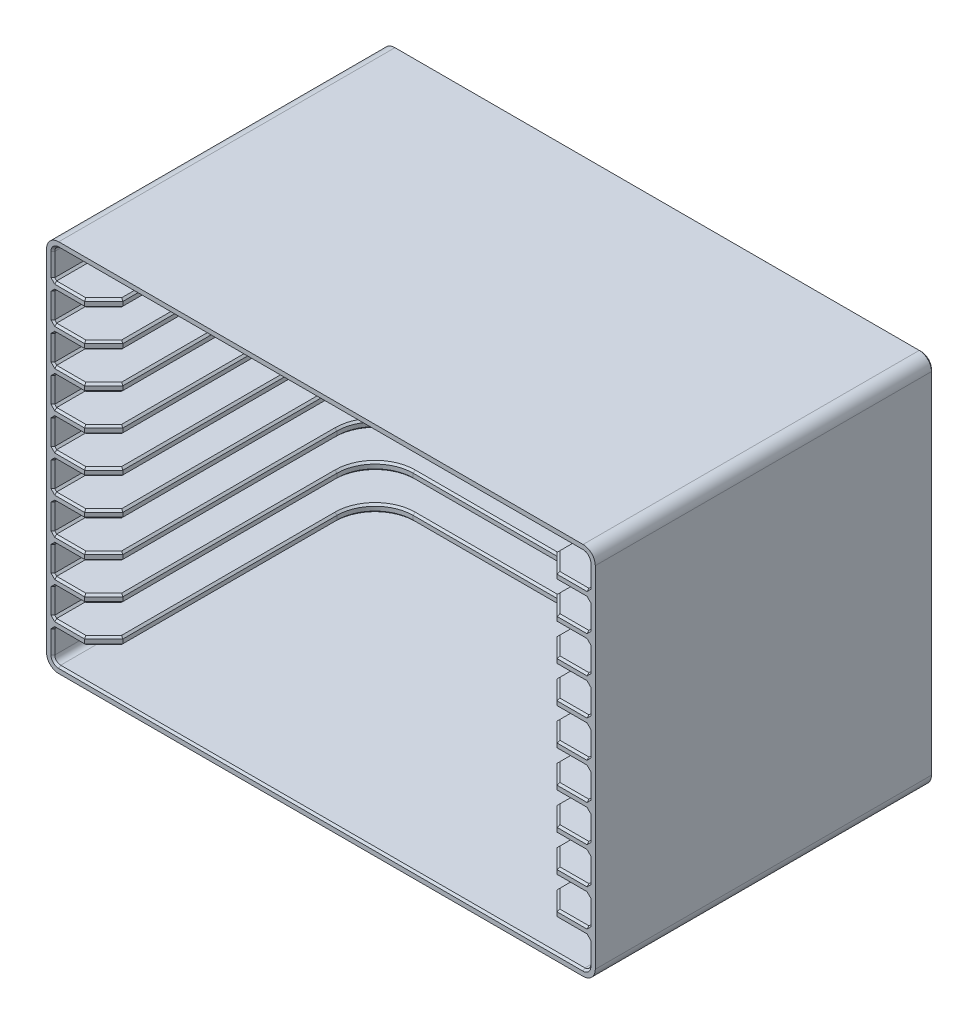
from build123d import *

# Parameters (mm, degrees)
BOSS_EXTRUDE1_DEPTH      = 106.4
CHAMFER1_SIZE            = 0.6
SHELL1_T                 = -2
SHELL1_THICKNESS_2_DEPTH = 3
DIVIDER_DEPTH            = 7
DIVIDER_POCKET_DEPTH     = 4.5
LPATTERN1_START          = -47.25
LPATTERN1_DEPTH          = 2.5
LPATTERN1_START_2        = -35.75
LPATTERN1_2_DEPTH        = 2.5
LPATTERN1_START_3        = -24.25
LPATTERN1_3_DEPTH        = 2.5
LPATTERN1_START_4        = 10.25
LPATTERN1_4_DEPTH        = 2.5
LPATTERN1_START_5        = 21.75
LPATTERN1_5_DEPTH        = 2.5
LPATTERN1_START_6        = 33.25
LPATTERN1_6_DEPTH        = 2.5
LPATTERN1_START_7        = 44.75
LPATTERN1_7_DEPTH        = 2.5
CHAMFER2_SIZE            = 0.6


# Read off the part's stored shape, not the designer's step: LPattern1
with BuildPart() as part:
    # Sketch1 → Boss-Extrude1 (new body)
    with BuildSketch(Plane.XY):
        with BuildLine():
            Line((-82.5, -58.85), (82.5, -58.85))
            ThreePointArc((82.5, -58.85), (85.222361108, -57.722361108), (86.35, -55))
            Line((86.35, -55), (86.35, 55))
            ThreePointArc((86.35, 55), (85.222361108, 57.722361108), (82.5, 58.85))
            Line((82.5, 58.85), (-82.5, 58.85))
            ThreePointArc((-82.5, 58.85), (-85.222361108, 57.722361108), (-86.35, 55))
            Line((-86.35, 55), (-86.35, -55))
            ThreePointArc((-86.35, -55), (-85.222361108, -57.722361108), (-82.5, -58.85))
        make_face()
    extrude(amount=BOSS_EXTRUDE1_DEPTH)

    # Chamfer1
    chamfer1_edges = [part.edges().sort_by_distance(p)[0] for p in [
        (0, -58.85, 0),
        (85.222361108, -57.722361108, 0),
        (86.35, 0, 0),
        (85.222361108, 57.722361108, 0),
        (0, 58.85, 0),
        (-85.222361108, 57.722361108, 0),
        (-86.35, 0, 0),
        (-85.222361108, -57.722361108, 0),
    ]]
    chamfer(chamfer1_edges, length=CHAMFER1_SIZE)

    # Shell1
    shell1_openings = [part.faces().sort_by_distance(p)[0] for p in [
        (0, 0, 106.4),
    ]]
    offset(amount=SHELL1_T, openings=shell1_openings, kind=Kind.INTERSECTION)

    # Shell1 thickness 2 face (on inner face of the shell) → Shell1 thickness 2 (add)
    with BuildSketch(Plane(origin=(0, 0, 2), x_dir=(-1, 0, 0), z_dir=(0, 0, -1))):
        with BuildLine():
            Line((-82.5, 56.85), (82.5, 56.85))
            ThreePointArc((82.5, 56.85), (83.808147545, 56.308147545), (84.35, 55))
            Line((84.35, 55), (84.35, -55))
            ThreePointArc((84.35, -55), (83.808147545, -56.308147545), (82.5, -56.85))
            Line((82.5, -56.85), (-82.5, -56.85))
            ThreePointArc((-82.5, -56.85), (-83.808147545, -56.308147545), (-84.35, -55))
            Line((-84.35, -55), (-84.35, 55))
            ThreePointArc((-84.35, 55), (-83.808147545, 56.308147545), (-82.5, 56.85))
        make_face()
    extrude(amount=-SHELL1_THICKNESS_2_DEPTH)

    # Sketch2 → Divider (add, symmetric)
    with BuildSketch(Plane(origin=(0, -5.75, 0), x_dir=(1, 0, 0), z_dir=(0, 1, 0))):
        with BuildLine():
            Line((-84.35, -106.4), (-84.35, -5))
            Line((-84.35, -5), (84.35, -5))
            Line((84.35, -5), (84.35, -106.4))
            Line((84.35, -106.4), (74.35, -106.4))
            Line((74.35, -106.4), (68.35, -100.4))
            Line((68.35, -100.4), (68.35, -33))
            ThreePointArc((68.35, -33), (64.835281374, -24.514718626), (56.35, -21))
            Line((56.35, -21), (-56.35, -21))
            ThreePointArc((-56.35, -21), (-64.835281374, -24.514718626), (-68.35, -33))
            Line((-68.35, -33), (-68.35, -100.4))
            Line((-68.35, -100.4), (-74.35, -106.4))
            Line((-74.35, -106.4), (-84.35, -106.4))
        make_face()
    extrude(amount=DIVIDER_DEPTH, both=True)

    # Sketch3 → Divider Pocket (cut, symmetric)
    with BuildSketch(Plane(origin=(0, -5.75, 0), x_dir=(1, 0, 0), z_dir=(0, 1, 0))):
        with BuildLine():
            Line((-56.35, -21), (56.35, -21))
            ThreePointArc((56.35, -21), (64.835281374, -24.514718626), (68.35, -33))
            Line((68.35, -33), (68.35, -100.4))
            Line((68.35, -100.4), (74.35, -106.4))
            Line((74.35, -106.4), (84.35, -106.4))
            Line((84.35, -106.4), (84.35, -5))
            Line((84.35, -5), (-84.35, -5))
            Line((-84.35, -5), (-84.35, -106.4))
            Line((-84.35, -106.4), (-74.35, -106.4))
            Line((-74.35, -106.4), (-68.35, -100.4))
            Line((-68.35, -100.4), (-68.35, -33))
            ThreePointArc((-68.35, -33), (-64.835281374, -24.514718626), (-56.35, -21))
        make_face()
    extrude(amount=DIVIDER_POCKET_DEPTH, both=True, mode=Mode.SUBTRACT)

    # LPattern1 outline → LPattern1 (add)
    with BuildSketch(Plane(origin=(0, 0, 0), x_dir=(1, 0, 0), z_dir=(0, 1, 0)).offset(LPATTERN1_START)):
        with BuildLine():
            Line((-74.35, -106.4), (-68.35, -100.4))
            Line((-68.35, -100.4), (-68.35, -33))
            ThreePointArc((-68.35, -33), (-64.835281374, -24.514718626), (-56.35, -21))
            Line((-56.35, -21), (56.35, -21))
            ThreePointArc((56.35, -21), (64.835281374, -24.514718626), (68.35, -33))
            Line((68.35, -33), (68.35, -100.4))
            Line((68.35, -100.4), (74.35, -106.4))
            Line((74.35, -106.4), (84.35, -106.4))
            Line((84.35, -106.4), (84.35, -5))
            Line((84.35, -5), (-84.35, -5))
            Line((-84.35, -5), (-84.35, -106.4))
            Line((-84.35, -106.4), (-74.35, -106.4))
        make_face()
    extrude(amount=LPATTERN1_DEPTH)

    # LPattern1 2 outline → LPattern1 2 (add)
    with BuildSketch(Plane(origin=(0, 0, 0), x_dir=(1, 0, 0), z_dir=(0, 1, 0)).offset(LPATTERN1_START_2)):
        with BuildLine():
            Line((-74.35, -106.4), (-68.35, -100.4))
            Line((-68.35, -100.4), (-68.35, -33))
            ThreePointArc((-68.35, -33), (-64.835281374, -24.514718626), (-56.35, -21))
            Line((-56.35, -21), (56.35, -21))
            ThreePointArc((56.35, -21), (64.835281374, -24.514718626), (68.35, -33))
            Line((68.35, -33), (68.35, -100.4))
            Line((68.35, -100.4), (74.35, -106.4))
            Line((74.35, -106.4), (84.35, -106.4))
            Line((84.35, -106.4), (84.35, -5))
            Line((84.35, -5), (-84.35, -5))
            Line((-84.35, -5), (-84.35, -106.4))
            Line((-84.35, -106.4), (-74.35, -106.4))
        make_face()
    extrude(amount=LPATTERN1_2_DEPTH)

    # LPattern1 3 outline → LPattern1 3 (add)
    with BuildSketch(Plane(origin=(0, 0, 0), x_dir=(1, 0, 0), z_dir=(0, 1, 0)).offset(LPATTERN1_START_3)):
        with BuildLine():
            Line((-74.35, -106.4), (-68.35, -100.4))
            Line((-68.35, -100.4), (-68.35, -33))
            ThreePointArc((-68.35, -33), (-64.835281374, -24.514718626), (-56.35, -21))
            Line((-56.35, -21), (56.35, -21))
            ThreePointArc((56.35, -21), (64.835281374, -24.514718626), (68.35, -33))
            Line((68.35, -33), (68.35, -100.4))
            Line((68.35, -100.4), (74.35, -106.4))
            Line((74.35, -106.4), (84.35, -106.4))
            Line((84.35, -106.4), (84.35, -5))
            Line((84.35, -5), (-84.35, -5))
            Line((-84.35, -5), (-84.35, -106.4))
            Line((-84.35, -106.4), (-74.35, -106.4))
        make_face()
    extrude(amount=LPATTERN1_3_DEPTH)

    # LPattern1 4 outline → LPattern1 4 (add)
    with BuildSketch(Plane(origin=(0, 0, 0), x_dir=(1, 0, 0), z_dir=(0, 1, 0)).offset(LPATTERN1_START_4)):
        with BuildLine():
            Line((-74.35, -106.4), (-68.35, -100.4))
            Line((-68.35, -100.4), (-68.35, -33))
            ThreePointArc((-68.35, -33), (-64.835281374, -24.514718626), (-56.35, -21))
            Line((-56.35, -21), (56.35, -21))
            ThreePointArc((56.35, -21), (64.835281374, -24.514718626), (68.35, -33))
            Line((68.35, -33), (68.35, -100.4))
            Line((68.35, -100.4), (74.35, -106.4))
            Line((74.35, -106.4), (84.35, -106.4))
            Line((84.35, -106.4), (84.35, -5))
            Line((84.35, -5), (-84.35, -5))
            Line((-84.35, -5), (-84.35, -106.4))
            Line((-84.35, -106.4), (-74.35, -106.4))
        make_face()
    extrude(amount=LPATTERN1_4_DEPTH)

    # LPattern1 5 outline → LPattern1 5 (add)
    with BuildSketch(Plane(origin=(0, 0, 0), x_dir=(1, 0, 0), z_dir=(0, 1, 0)).offset(LPATTERN1_START_5)):
        with BuildLine():
            Line((-74.35, -106.4), (-68.35, -100.4))
            Line((-68.35, -100.4), (-68.35, -33))
            ThreePointArc((-68.35, -33), (-64.835281374, -24.514718626), (-56.35, -21))
            Line((-56.35, -21), (56.35, -21))
            ThreePointArc((56.35, -21), (64.835281374, -24.514718626), (68.35, -33))
            Line((68.35, -33), (68.35, -100.4))
            Line((68.35, -100.4), (74.35, -106.4))
            Line((74.35, -106.4), (84.35, -106.4))
            Line((84.35, -106.4), (84.35, -5))
            Line((84.35, -5), (-84.35, -5))
            Line((-84.35, -5), (-84.35, -106.4))
            Line((-84.35, -106.4), (-74.35, -106.4))
        make_face()
    extrude(amount=LPATTERN1_5_DEPTH)

    # LPattern1 6 outline → LPattern1 6 (add)
    with BuildSketch(Plane(origin=(0, 0, 0), x_dir=(1, 0, 0), z_dir=(0, 1, 0)).offset(LPATTERN1_START_6)):
        with BuildLine():
            Line((-74.35, -106.4), (-68.35, -100.4))
            Line((-68.35, -100.4), (-68.35, -33))
            ThreePointArc((-68.35, -33), (-64.835281374, -24.514718626), (-56.35, -21))
            Line((-56.35, -21), (56.35, -21))
            ThreePointArc((56.35, -21), (64.835281374, -24.514718626), (68.35, -33))
            Line((68.35, -33), (68.35, -100.4))
            Line((68.35, -100.4), (74.35, -106.4))
            Line((74.35, -106.4), (84.35, -106.4))
            Line((84.35, -106.4), (84.35, -5))
            Line((84.35, -5), (-84.35, -5))
            Line((-84.35, -5), (-84.35, -106.4))
            Line((-84.35, -106.4), (-74.35, -106.4))
        make_face()
    extrude(amount=LPATTERN1_6_DEPTH)

    # LPattern1 7 outline → LPattern1 7 (add)
    with BuildSketch(Plane(origin=(0, 0, 0), x_dir=(1, 0, 0), z_dir=(0, 1, 0)).offset(LPATTERN1_START_7)):
        with BuildLine():
            Line((-74.35, -106.4), (-68.35, -100.4))
            Line((-68.35, -100.4), (-68.35, -33))
            ThreePointArc((-68.35, -33), (-64.835281374, -24.514718626), (-56.35, -21))
            Line((-56.35, -21), (56.35, -21))
            ThreePointArc((56.35, -21), (64.835281374, -24.514718626), (68.35, -33))
            Line((68.35, -33), (68.35, -100.4))
            Line((68.35, -100.4), (74.35, -106.4))
            Line((74.35, -106.4), (84.35, -106.4))
            Line((84.35, -106.4), (84.35, -5))
            Line((84.35, -5), (-84.35, -5))
            Line((-84.35, -5), (-84.35, -106.4))
            Line((-84.35, -106.4), (-74.35, -106.4))
        make_face()
    extrude(amount=LPATTERN1_7_DEPTH)

    # Chamfer2
    chamfer2_edges = [part.edges().sort_by_distance(p)[0] for p in [
        (84.35, 51.125, 106.4),
        (-84.35, -51.125, 106.4),
        (-68.35, -47.25, 66.7),
        (-64.835281374, -47.25, 24.514718626),
        (0, -47.25, 21),
        (64.835281374, -47.25, 24.514718626),
        (68.35, -47.25, 66.7),
        (-79.35, -47.25, 106.4),
        (-71.35, -47.25, 103.4),
        (71.35, -47.25, 103.4),
        (79.35, -47.25, 106.4),
        (84.35, -47.25, 55.7),
        (0, -47.25, 5),
        (-84.35, -47.25, 55.7),
        (-79.35, 47.25, 106.4),
        (-71.35, 47.25, 103.4),
        (-68.35, 47.25, 66.7),
        (-64.835281374, 47.25, 24.514718626),
        (0, 47.25, 21),
        (64.835281374, 47.25, 24.514718626),
        (68.35, 47.25, 66.7),
        (71.35, 47.25, 103.4),
        (79.35, 47.25, 106.4),
        (84.35, 47.25, 55.7),
        (0, 47.25, 5),
        (-84.35, 47.25, 55.7),
        (64.835281374, 35.75, 24.514718626),
        (0, 35.75, 21),
        (-64.835281374, 35.75, 24.514718626),
        (-68.35, 35.75, 66.7),
        (-71.35, 35.75, 103.4),
        (-79.35, 35.75, 106.4),
        (-84.35, 35.75, 55.7),
        (-84.35, 40.25, 106.4),
        (0, 35.75, 5),
        (84.35, 35.75, 55.7),
        (79.35, 35.75, 106.4),
        (84.35, 40.25, 106.4),
        (71.35, 35.75, 103.4),
        (68.35, 35.75, 66.7),
        (64.835281374, 44.75, 24.514718626),
        (68.35, 44.75, 66.7),
        (71.35, 44.75, 103.4),
        (79.35, 44.75, 106.4),
        (84.35, 44.75, 55.7),
        (0, 44.75, 5),
        (-84.35, 44.75, 55.7),
        (-79.35, 44.75, 106.4),
        (-71.35, 44.75, 103.4),
        (-68.35, 44.75, 66.7),
        (-64.835281374, 44.75, 24.514718626),
        (0, 44.75, 21),
        (64.835281374, 24.25, 24.514718626),
        (0, 24.25, 21),
        (-64.835281374, 24.25, 24.514718626),
        (-68.35, 24.25, 66.7),
        (-71.35, 24.25, 103.4),
        (-79.35, 24.25, 106.4),
        (-84.35, 24.25, 55.7),
        (-84.35, 28.75, 106.4),
        (0, 24.25, 5),
        (84.35, 24.25, 55.7),
        (79.35, 24.25, 106.4),
        (84.35, 28.75, 106.4),
        (71.35, 24.25, 103.4),
        (68.35, 24.25, 66.7),
        (64.835281374, 33.25, 24.514718626),
        (68.35, 33.25, 66.7),
        (71.35, 33.25, 103.4),
        (79.35, 33.25, 106.4),
        (84.35, 33.25, 55.7),
        (0, 33.25, 5),
        (-84.35, 33.25, 55.7),
        (-79.35, 33.25, 106.4),
        (-71.35, 33.25, 103.4),
        (-68.35, 33.25, 66.7),
        (-64.835281374, 33.25, 24.514718626),
        (0, 33.25, 21),
        (64.835281374, 12.75, 24.514718626),
        (0, 12.75, 21),
        (-64.835281374, 12.75, 24.514718626),
        (-68.35, 12.75, 66.7),
        (-71.35, 12.75, 103.4),
        (-79.35, 12.75, 106.4),
        (-84.35, 12.75, 55.7),
        (-84.35, 17.25, 106.4),
        (0, 12.75, 5),
        (84.35, 12.75, 55.7),
        (79.35, 12.75, 106.4),
        (84.35, 17.25, 106.4),
        (71.35, 12.75, 103.4),
        (68.35, 12.75, 66.7),
        (64.835281374, 21.75, 24.514718626),
        (68.35, 21.75, 66.7),
        (71.35, 21.75, 103.4),
        (79.35, 21.75, 106.4),
        (84.35, 21.75, 55.7),
        (0, 21.75, 5),
        (-84.35, 21.75, 55.7),
        (-79.35, 21.75, 106.4),
        (-71.35, 21.75, 103.4),
        (-68.35, 21.75, 66.7),
        (-64.835281374, 21.75, 24.514718626),
        (0, 21.75, 21),
        (64.835281374, -10.25, 24.514718626),
        (0, -10.25, 21),
        (-64.835281374, -10.25, 24.514718626),
        (-68.35, -10.25, 66.7),
        (-71.35, -10.25, 103.4),
        (-79.35, -10.25, 106.4),
        (-84.35, -10.25, 55.7),
        (-84.35, -5.75, 106.4),
        (0, -10.25, 5),
        (84.35, -10.25, 55.7),
        (79.35, -10.25, 106.4),
        (84.35, -5.75, 106.4),
        (71.35, -10.25, 103.4),
        (68.35, -10.25, 66.7),
        (64.835281374, -1.25, 24.514718626),
        (68.35, -1.25, 66.7),
        (71.35, -1.25, 103.4),
        (79.35, -1.25, 106.4),
        (84.35, -1.25, 55.7),
        (0, -1.25, 5),
        (-84.35, -1.25, 55.7),
        (-79.35, -1.25, 106.4),
        (-71.35, -1.25, 103.4),
        (-68.35, -1.25, 66.7),
        (-64.835281374, -1.25, 24.514718626),
        (0, -1.25, 21),
        (64.835281374, 1.25, 24.514718626),
        (0, 1.25, 21),
        (-64.835281374, 1.25, 24.514718626),
        (-68.35, 1.25, 66.7),
        (-71.35, 1.25, 103.4),
        (-79.35, 1.25, 106.4),
        (-84.35, 1.25, 55.7),
        (-84.35, 5.75, 106.4),
        (0, 1.25, 5),
        (84.35, 1.25, 55.7),
        (79.35, 1.25, 106.4),
        (84.35, 5.75, 106.4),
        (71.35, 1.25, 103.4),
        (68.35, 1.25, 66.7),
        (64.835281374, 10.25, 24.514718626),
        (68.35, 10.25, 66.7),
        (71.35, 10.25, 103.4),
        (79.35, 10.25, 106.4),
        (84.35, 10.25, 55.7),
        (0, 10.25, 5),
        (-84.35, 10.25, 55.7),
        (-79.35, 10.25, 106.4),
        (-71.35, 10.25, 103.4),
        (-68.35, 10.25, 66.7),
        (-64.835281374, 10.25, 24.514718626),
        (0, 10.25, 21),
        (64.835281374, -44.75, 24.514718626),
        (0, -44.75, 21),
        (-64.835281374, -44.75, 24.514718626),
        (-68.35, -44.75, 66.7),
        (-71.35, -44.75, 103.4),
        (-79.35, -44.75, 106.4),
        (-84.35, -44.75, 55.7),
        (-84.35, -40.25, 106.4),
        (0, -44.75, 5),
        (84.35, -44.75, 55.7),
        (79.35, -44.75, 106.4),
        (84.35, -40.25, 106.4),
        (71.35, -44.75, 103.4),
        (68.35, -44.75, 66.7),
        (64.835281374, -35.75, 24.514718626),
        (68.35, -35.75, 66.7),
        (71.35, -35.75, 103.4),
        (79.35, -35.75, 106.4),
        (84.35, -35.75, 55.7),
        (0, -35.75, 5),
        (-84.35, -35.75, 55.7),
        (-79.35, -35.75, 106.4),
        (-71.35, -35.75, 103.4),
        (-68.35, -35.75, 66.7),
        (-64.835281374, -35.75, 24.514718626),
        (0, -35.75, 21),
        (64.835281374, -33.25, 24.514718626),
        (0, -33.25, 21),
        (-64.835281374, -33.25, 24.514718626),
        (-68.35, -33.25, 66.7),
        (-71.35, -33.25, 103.4),
        (-79.35, -33.25, 106.4),
        (-84.35, -33.25, 55.7),
        (-84.35, -28.75, 106.4),
        (0, -33.25, 5),
        (84.35, -33.25, 55.7),
        (79.35, -33.25, 106.4),
        (84.35, -28.75, 106.4),
        (71.35, -33.25, 103.4),
        (68.35, -33.25, 66.7),
        (64.835281374, -24.25, 24.514718626),
        (68.35, -24.25, 66.7),
        (71.35, -24.25, 103.4),
        (79.35, -24.25, 106.4),
        (84.35, -24.25, 55.7),
        (0, -24.25, 5),
        (-84.35, -24.25, 55.7),
        (-79.35, -24.25, 106.4),
        (-71.35, -24.25, 103.4),
        (-68.35, -24.25, 66.7),
        (-64.835281374, -24.25, 24.514718626),
        (0, -24.25, 21),
        (64.835281374, -21.75, 24.514718626),
        (0, -21.75, 21),
        (-64.835281374, -21.75, 24.514718626),
        (-68.35, -21.75, 66.7),
        (-71.35, -21.75, 103.4),
        (-79.35, -21.75, 106.4),
        (-84.35, -21.75, 55.7),
        (-84.35, -17.25, 106.4),
        (0, -21.75, 5),
        (84.35, -21.75, 55.7),
        (79.35, -21.75, 106.4),
        (84.35, -17.25, 106.4),
        (71.35, -21.75, 103.4),
        (68.35, -21.75, 66.7),
        (64.835281374, -12.75, 24.514718626),
        (68.35, -12.75, 66.7),
        (71.35, -12.75, 103.4),
        (79.35, -12.75, 106.4),
        (84.35, -12.75, 55.7),
        (0, -12.75, 5),
        (-84.35, -12.75, 55.7),
        (-79.35, -12.75, 106.4),
        (-71.35, -12.75, 103.4),
        (-68.35, -12.75, 66.7),
        (-64.835281374, -12.75, 24.514718626),
        (0, -12.75, 21),
        (-84.35, 51.125, 106.4),
        (-83.808147545, -56.308147545, 106.4),
        (0, -56.85, 106.4),
        (83.808147545, -56.308147545, 106.4),
        (84.35, -51.125, 106.4),
        (83.808147545, 56.308147545, 106.4),
        (0, 56.85, 106.4),
        (-83.808147545, 56.308147545, 106.4),
    ]]
    chamfer(chamfer2_edges, length=CHAMFER2_SIZE)


solid = part.part
